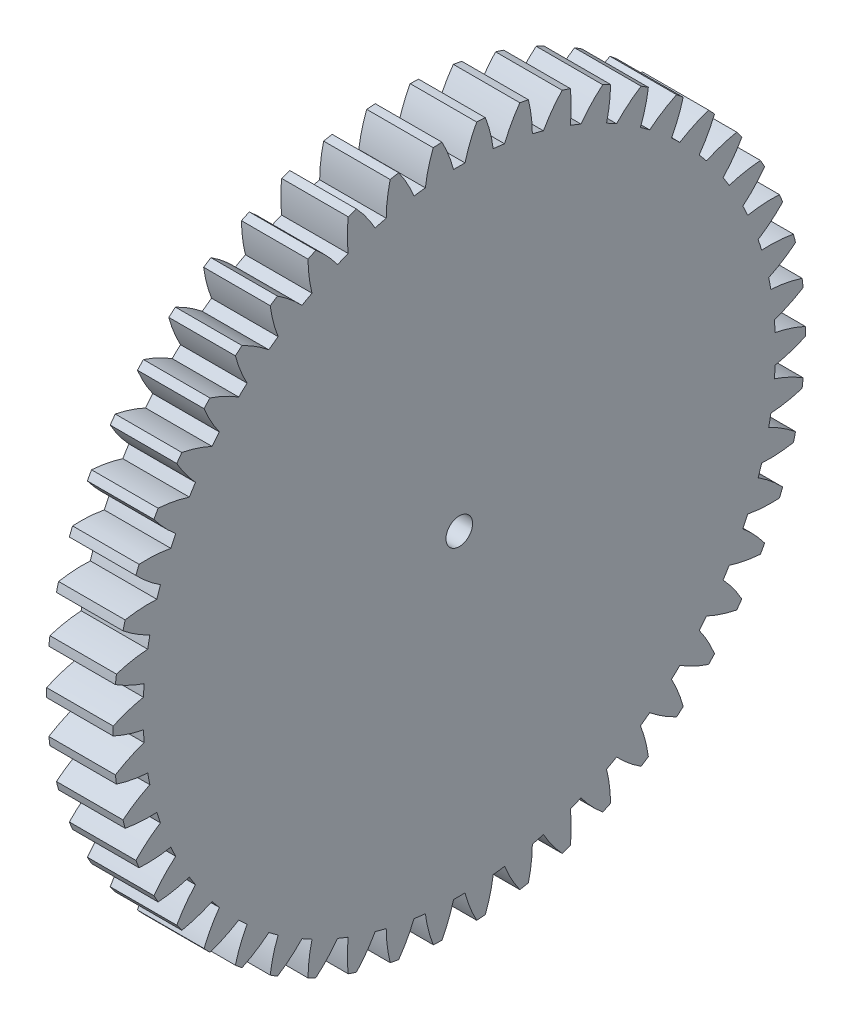
from build123d import *

# Parameters (mm, degrees)
BASPROSKE_W      = 10
BASPROSKE_H      = 52
TOOTHCUT_DEPTH   = 75.215901261
TEETHCUTS_COUNT  = 50
TEETHCUTS_ANGLE  = 352.8
HUBNEAONESKE_R   = 25
HUBNEARONE_DEPTH = 10.0000508
BORSKE_R         = 2
BORE_DEPTH       = 20.0000508


with BuildPart() as part:
    # BasProSke → Base-Revolve (revolve)
    with BuildSketch(Plane(origin=(0, 0, 0), x_dir=(1, 0, 0), z_dir=(0, 1, 0))):
        with Locations((5, 26)):
            Rectangle(BASPROSKE_W, BASPROSKE_H)
    revolve(axis=Axis((-10, 0, 0), (1, 0, 0)))

    # TooCutSke → ToothCut (cut, through all)
    with BuildSketch(Plane(origin=(0, 0, 0), x_dir=(0, 0, -1), z_dir=(1, 0, 0))):
        with BuildLine():
            ThreePointArc((0.86062222, 47.491202663), (0, 47.499), (-0.86062222, 47.491202663))
            ThreePointArc((-0.86062222, 47.491202663), (-1.610166517, 49.778366785), (-2.629027787, 51.958930494))
            ThreePointArc((-2.629027787, 51.958930494), (0, 52.0254), (2.629027787, 51.958930494))
            ThreePointArc((2.629027787, 51.958930494), (1.610166517, 49.778366785), (0.86062222, 47.491202663))
        make_face()
    toothcut = extrude(amount=TOOTHCUT_DEPTH, mode=Mode.SUBTRACT)

    # TeethCuts: ToothCut ×50 about axis
    teethcuts_axis = Axis((-10, 0, 0), (1, 0, 0))
    for i in range(1, TEETHCUTS_COUNT):
        add(toothcut.rotate(teethcuts_axis, i * TEETHCUTS_ANGLE / (TEETHCUTS_COUNT - 1)), mode=Mode.SUBTRACT)

    # HubNeaOneSke → HubNearOne (add)
    with BuildSketch(Plane.ZY):
        Circle(HUBNEAONESKE_R)
    extrude(amount=HUBNEARONE_DEPTH)

    # BorSke → Bore (cut, symmetric)
    with BuildSketch(Plane(origin=(0, 0, 0), x_dir=(0, 0, -1), z_dir=(1, 0, 0))):
        Circle(BORSKE_R)
    extrude(amount=BORE_DEPTH, both=True, mode=Mode.SUBTRACT)


solid = part.part
